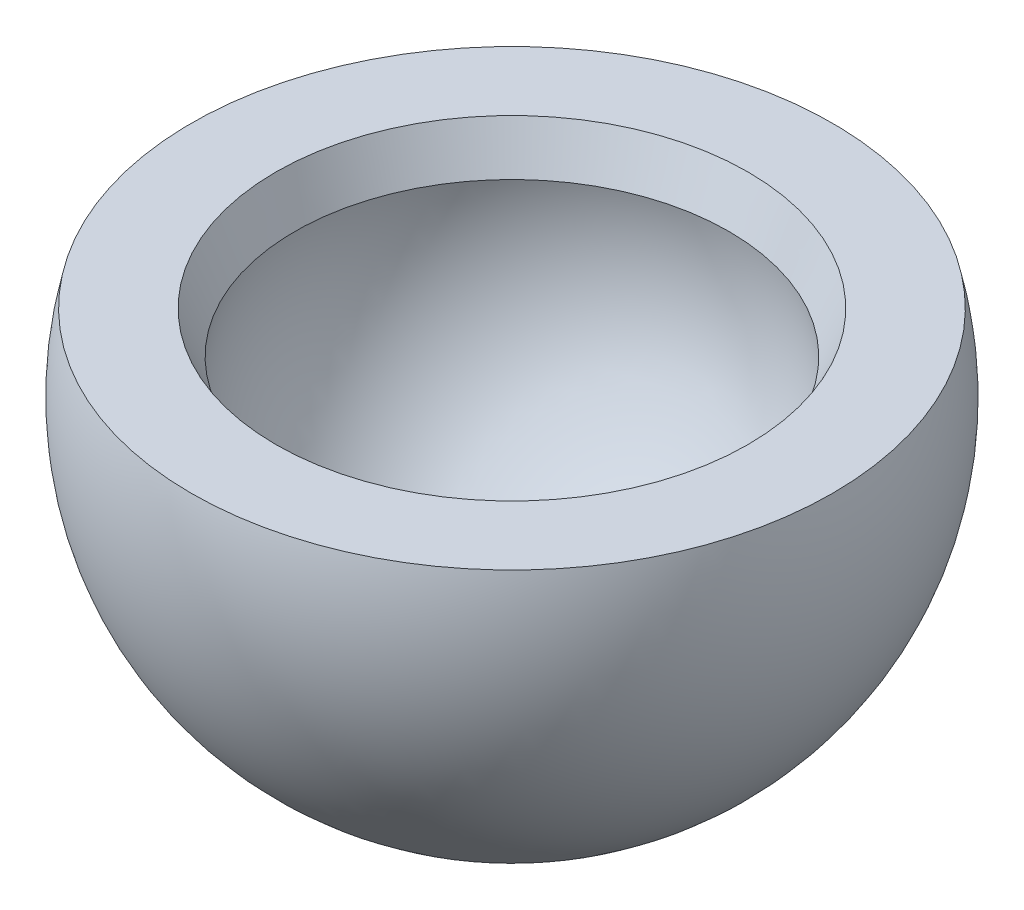
from build123d import *

# Parameters (mm, degrees)
SKETCH2_R      = 37.82695
EXTRUDE1_DEPTH = 50.8
CHAMFER1_SIZE  = 3.489517659


with BuildPart() as part:
    # Sketch1 → Revolve1 (revolve)
    with BuildSketch(Plane.XY):
        with BuildLine():
            Line((0, 38.1), (0, -38.1))
            ThreePointArc((0, -38.1), (38.1, 0), (0, 38.1))
        make_face()
    revolve(axis=Axis((0, 38.1, 0), (0, -1, 0)))

    # Sketch2 → Extrude1 (cut)
    with BuildSketch(Plane(origin=(0, 8.89, 0), x_dir=(-1, 0, 0), z_dir=(0, 1, 0))):
        Circle(SKETCH2_R)
    extrude(amount=EXTRUDE1_DEPTH, mode=Mode.SUBTRACT)

    # Sketch3 → Cut-Revolve1 (revolve, cut)
    with BuildSketch(Plane(origin=(0, 0, 0), x_dir=(1, 0, 0), z_dir=(0, 1, 0))):
        with BuildLine():
            Line((0, 25.4), (0, -25.4))
            ThreePointArc((0, -25.4), (25.4, 0), (0, 25.4))
        make_face()
    revolve(axis=Axis((0, 0, -25.4), (0, 0, 1)), mode=Mode.SUBTRACT)

    # Chamfer1
    # the kernel refuses this chamfer: 4.4901358, 3.489517659 mm, written as the material it takes off along each edge
    with BuildSketch(Plane(origin=(0, 8.89, 0), x_dir=(0, 0, 1), z_dir=(-1, 0, 0))) as chamfer1_piece_1:
        with BuildLine():
            Line((23.793442374 + CHAMFER1_SIZE, 0), (25.07527625, -4.841479162))
            ThreePointArc((25.07527625, -4.841479162), (24.571788855, -2.456712156), (23.793442374, 0))
            Line((23.793442374, 0), (23.793442374 + CHAMFER1_SIZE, 0))
        make_face()
    revolve(axis=Axis((0, 8.89, 0), (0, 1, 0)), mode=Mode.SUBTRACT)


solid = part.part
